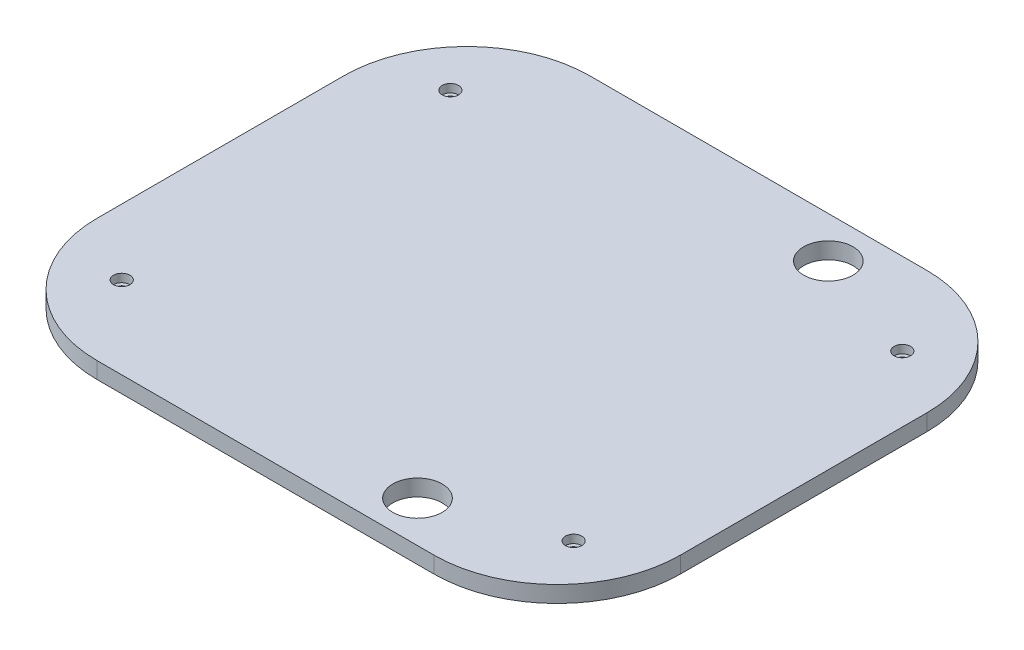
from build123d import *

# Parameters (mm, degrees)
SKETCH11_W                     = 355
SKETCH11_H                     = 300
SKETCH11_R                     = 15
BOSS_EXTRUDE2_DEPTH            = 10
CBORE_START                    = 5
CBORE_FOR_M5_SHCS1_OUTLINE_R   = 5
CBORE_FOR_M5_SHCS1_DEPTH       = 5
CBORE_FOR_M5_SHCS1_2_OUTLINE_R = 2.75
CBORE_FOR_M5_SHCS1_2_DEPTH     = 5
FILLET1_R                      = 75


# Read off the part's stored shape, not the designer's step: CBORE for M5 SHCS1
with BuildPart() as part:
    # Sketch11 → Boss-Extrude2 (new body)
    with BuildSketch(Plane(origin=(0, 0, 0), x_dir=(1, 0, 0), z_dir=(0, 1, 0))):
        Rectangle(SKETCH11_W, SKETCH11_H)
        with Locations(Location((67.5, -125, 0), (0, 0, 270))):
            Circle(SKETCH11_R, mode=Mode.SUBTRACT)
        with Locations(Location((67.5, 125, 0), (0, 0, 270))):
            Circle(SKETCH11_R, mode=Mode.SUBTRACT)
    extrude(amount=BOSS_EXTRUDE2_DEPTH)

    # CBORE for M5 SHCS1 outline → CBORE for M5 SHCS1 (cut)
    with BuildSketch(Plane(origin=(0, 0, 0), x_dir=(1, 0, 0), z_dir=(0, 1, 0)).offset(CBORE_START)):
        with Locations((137.5, 100)):
            Circle(CBORE_FOR_M5_SHCS1_OUTLINE_R)
        with Locations((-137.5, -100)):
            Circle(CBORE_FOR_M5_SHCS1_OUTLINE_R)
        with Locations((-137.5, 100)):
            Circle(CBORE_FOR_M5_SHCS1_OUTLINE_R)
        with Locations((137.5, -100)):
            Circle(CBORE_FOR_M5_SHCS1_OUTLINE_R)
    extrude(amount=CBORE_FOR_M5_SHCS1_DEPTH, mode=Mode.SUBTRACT)

    # CBORE for M5 SHCS1 2 outline → CBORE for M5 SHCS1 2 (cut)
    with BuildSketch(Plane(origin=(0, 0, 0), x_dir=(1, 0, 0), z_dir=(0, 1, 0))):
        with Locations((137.5, 100)):
            Circle(CBORE_FOR_M5_SHCS1_2_OUTLINE_R)
        with Locations((-137.5, -100)):
            Circle(CBORE_FOR_M5_SHCS1_2_OUTLINE_R)
        with Locations((-137.5, 100)):
            Circle(CBORE_FOR_M5_SHCS1_2_OUTLINE_R)
        with Locations((137.5, -100)):
            Circle(CBORE_FOR_M5_SHCS1_2_OUTLINE_R)
    extrude(amount=CBORE_FOR_M5_SHCS1_2_DEPTH, mode=Mode.SUBTRACT)

    # Fillet1
    fillet1_edges = [part.edges().sort_by_distance(p)[0] for p in [
        (177.5, 5, -150),
        (177.5, 5, 150),
        (-177.5, 5, 150),
        (-177.5, 5, -150),
    ]]
    fillet(fillet1_edges, radius=FILLET1_R)


solid = part.part
